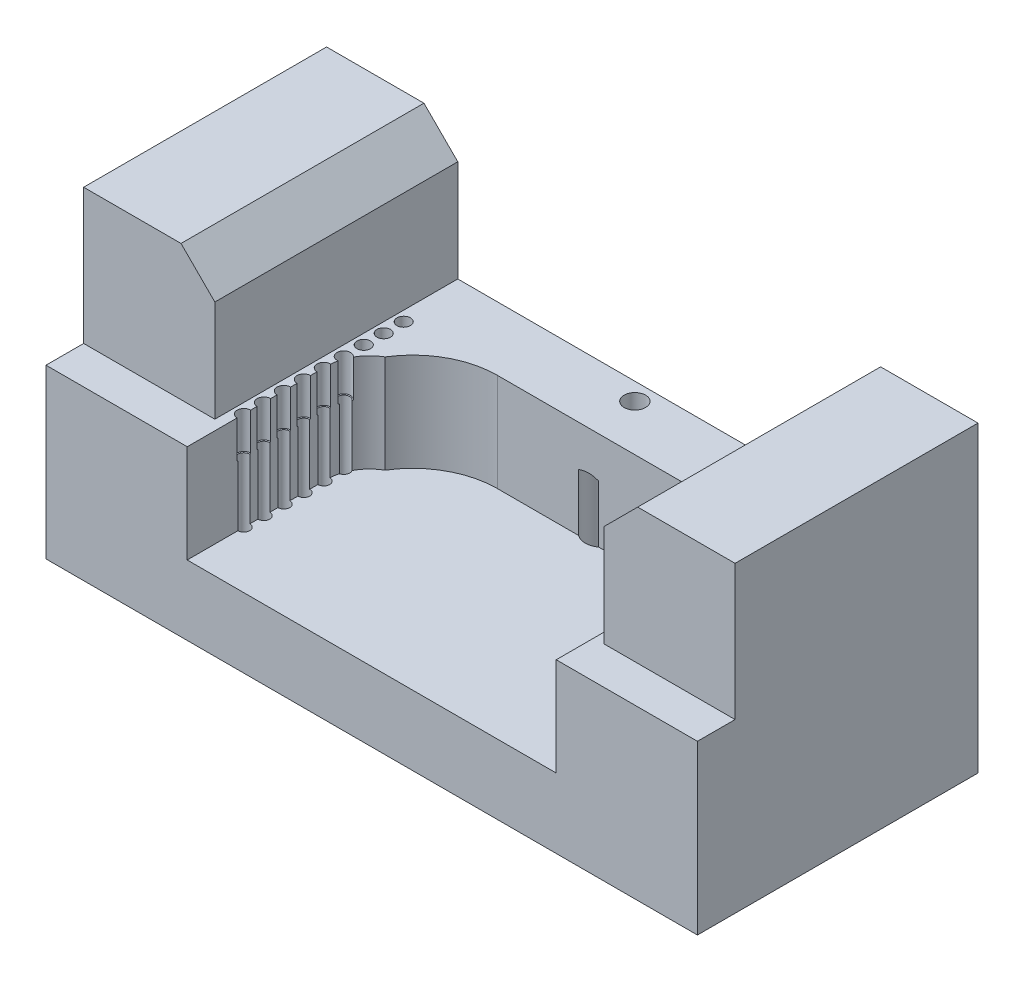
from build123d import *

# Parameters (mm, degrees)
SKETCH2_W                        = 48.915002
SKETCH2_H                        = 21.0677944
BOSS_EXTRUDE1_DEPTH              = 12.599999946
SKETCH1_R                        = 0.4445
CUT_EXTRUDE1_DEPTH               = 36.740394334
SKETCH3_R                        = 0.508
CUT_EXTRUDE2_DEPTH               = 2.794
SKETCH4_W                        = 9.852501
SKETCH4_H                        = 18.2412951
BOSS_EXTRUDE2_DEPTH              = 10.16
CHAMFER1_SIZE                    = 2.54
SKETCH5_W                        = 26.416
SKETCH5_H                        = 26.766649332
CUT_EXTRUDE3_DEPTH               = 7.366
FILLET1_R                        = 6.35
F_52_0_0635_DIAMETER_HOLE1_D     = 1.6129
F_52_0_0635_DIAMETER_HOLE1_DEPTH = 3.0988
F_52_0_0635_DIAMETER_HOLE1_TIP   = 0.484564046
CUT_EXTRUDE4_DEPTH               = 7.366
F_39_0_0995_DIAMETER_HOLE1_D     = 2.5273
F_39_0_0995_DIAMETER_HOLE1_DEPTH = 9.525
F_39_0_0995_DIAMETER_HOLE1_TIP   = 0.759277521


# Read off the part's stored shape, not the designer's step: Cut-Extrude6
with BuildPart() as part:
    # Sketch2 → Boss-Extrude1 (new body)
    with BuildSketch(Plane(origin=(0, 0, 0), x_dir=(1, 0, 0), z_dir=(0, 1, 0))):
        with Locations((0, 12.2793979)):
            Rectangle(SKETCH2_W, SKETCH2_H)
    extrude(amount=-BOSS_EXTRUDE1_DEPTH)

    # Sketch1 → Cut-Extrude1 (cut, through all)
    with BuildSketch(Plane(origin=(0, 0, 0), x_dir=(1, 0, 0), z_dir=(0, 1, 0))):
        with Locations(Location((-13.853001, 6.0000007, 0), (0, 0, 270))):
            Circle(SKETCH1_R)
        with Locations(Location((13.853001, 5.78000114, 0), (0, 0, 270))):
            Circle(SKETCH1_R)
        with Locations(Location((-13.853001, 7.5, 0), (0, 0, 270))):
            Circle(SKETCH1_R)
        with Locations(Location((13.853001, 7.28000044, 0), (0, 0, 270))):
            Circle(SKETCH1_R)
        with Locations(Location((-13.853001, 8.9999993, 0), (0, 0, 270))):
            Circle(SKETCH1_R)
        with Locations(Location((13.853001, 8.77999974, 0), (0, 0, 270))):
            Circle(SKETCH1_R)
        with Locations(Location((-13.853001, 10.4999986, 0), (0, 0, 270))):
            Circle(SKETCH1_R)
        with Locations(Location((13.853001, 10.27999904, 0), (0, 0, 270))):
            Circle(SKETCH1_R)
        with Locations(Location((-13.853001, 11.9999979, 0), (0, 0, 270))):
            Circle(SKETCH1_R)
        with Locations(Location((13.853001, 11.77999834, 0), (0, 0, 270))):
            Circle(SKETCH1_R)
        with Locations(Location((-13.853001, 13.4999972, 0), (0, 0, 270))):
            Circle(SKETCH1_R)
        with Locations(Location((13.853001, 13.27999764, 0), (0, 0, 270))):
            Circle(SKETCH1_R)
        with Locations(Location((-13.853001, 14.9999965, 0), (0, 0, 270))):
            Circle(SKETCH1_R)
        with Locations(Location((13.853001, 14.77999694, 0), (0, 0, 270))):
            Circle(SKETCH1_R)
        with Locations(Location((-13.853001, 16.4999958, 0), (0, 0, 270))):
            Circle(SKETCH1_R)
        with Locations(Location((13.853001, 16.27999624, 0), (0, 0, 270))):
            Circle(SKETCH1_R)
        with Locations(Location((-13.853001, 17.9999951, 0), (0, 0, 270))):
            Circle(SKETCH1_R)
        with Locations(Location((13.853001, 17.77999554, 0), (0, 0, 270))):
            Circle(SKETCH1_R)
    extrude(amount=-CUT_EXTRUDE1_DEPTH, mode=Mode.SUBTRACT)

    # Sketch3 → Cut-Extrude2 (cut)
    with BuildSketch(Plane(origin=(0, 0, 0), x_dir=(1, 0, 0), z_dir=(0, 1, 0))):
        with Locations(Location((-13.853001, 6.0000007, 0), (0, 0, 270))):
            Circle(SKETCH3_R)
        with Locations(Location((13.853001, 5.78000114, 0), (0, 0, 270))):
            Circle(SKETCH3_R)
        with Locations(Location((-13.853001, 7.5, 0), (0, 0, 270))):
            Circle(SKETCH3_R)
        with Locations(Location((13.853001, 7.28000044, 0), (0, 0, 270))):
            Circle(SKETCH3_R)
        with Locations(Location((-13.853001, 8.9999993, 0), (0, 0, 270))):
            Circle(SKETCH3_R)
        with Locations(Location((13.853001, 8.77999974, 0), (0, 0, 270))):
            Circle(SKETCH3_R)
        with Locations(Location((-13.853001, 10.4999986, 0), (0, 0, 270))):
            Circle(SKETCH3_R)
        with Locations(Location((13.853001, 10.27999904, 0), (0, 0, 270))):
            Circle(SKETCH3_R)
        with Locations(Location((-13.853001, 11.9999979, 0), (0, 0, 270))):
            Circle(SKETCH3_R)
        with Locations(Location((13.853001, 11.77999834, 0), (0, 0, 270))):
            Circle(SKETCH3_R)
        with Locations(Location((-13.853001, 13.4999972, 0), (0, 0, 270))):
            Circle(SKETCH3_R)
        with Locations(Location((13.853001, 13.27999764, 0), (0, 0, 270))):
            Circle(SKETCH3_R)
        with Locations(Location((-13.853001, 14.9999965, 0), (0, 0, 270))):
            Circle(SKETCH3_R)
        with Locations(Location((13.853001, 14.77999694, 0), (0, 0, 270))):
            Circle(SKETCH3_R)
        with Locations(Location((-13.853001, 16.4999958, 0), (0, 0, 270))):
            Circle(SKETCH3_R)
        with Locations(Location((13.853001, 16.27999624, 0), (0, 0, 270))):
            Circle(SKETCH3_R)
        with Locations(Location((-13.853001, 17.9999951, 0), (0, 0, 270))):
            Circle(SKETCH3_R)
        with Locations(Location((13.853001, 17.77999554, 0), (0, 0, 270))):
            Circle(SKETCH3_R)
    extrude(amount=-CUT_EXTRUDE2_DEPTH, mode=Mode.SUBTRACT)

    # Sketch4 → Boss-Extrude2 (add)
    with BuildSketch(Plane(origin=(0, 0, 0), x_dir=(1, 0, 0), z_dir=(0, 1, 0))):
        with Locations((-19.5312505, 13.69264755)):
            Rectangle(SKETCH4_W, SKETCH4_H)
        with Locations((19.5312505, 13.69264755)):
            Rectangle(SKETCH4_W, SKETCH4_H)
    extrude(amount=BOSS_EXTRUDE2_DEPTH)

    # Chamfer1
    chamfer1_edges = [part.edges().sort_by_distance(p)[0] for p in [
        (14.605, 10.16, -13.69264755),
        (-14.605, 10.16, -13.69264755),
    ]]
    chamfer(chamfer1_edges, length=CHAMFER1_SIZE)

    # Sketch5 → Cut-Extrude3 (cut)
    with BuildSketch(Plane(origin=(0, 0, 0), x_dir=(1, 0, 0), z_dir=(0, 1, 0))):
        with Locations((0, 4.650675334)):
            Rectangle(SKETCH5_W, SKETCH5_H)
    extrude(amount=-CUT_EXTRUDE3_DEPTH, mode=Mode.SUBTRACT)

    # Fillet1
    fillet1_edges = [part.edges().sort_by_distance(p)[0] for p in [
        (13.208, -3.683, -18.034),
        (-13.208, -3.683, -18.034),
    ]]
    fillet(fillet1_edges, radius=FILLET1_R)

    # #52 (0.0635) Diameter Hole1
    with Locations(Plane(origin=(0, 0, 0), x_dir=(1, 0, 0), z_dir=(0, 1, 0))):
        with Locations((0, 21.50320058)):
            Hole(F_52_0_0635_DIAMETER_HOLE1_D / 2, depth=F_52_0_0635_DIAMETER_HOLE1_DEPTH)
            with Locations((0, 0, -(F_52_0_0635_DIAMETER_HOLE1_DEPTH + F_52_0_0635_DIAMETER_HOLE1_TIP / 2))):  # 118° drill point
                Cone(0, F_52_0_0635_DIAMETER_HOLE1_D / 2, F_52_0_0635_DIAMETER_HOLE1_TIP, mode=Mode.SUBTRACT)

    # Sketch9 → Cut-Extrude4 (cut)
    with BuildSketch(Plane(origin=(0, 0, 0), x_dir=(1, 0, 0), z_dir=(0, 1, 0))):
        with BuildLine():
            Line((-13.853001, 0), (13.853001, 0))
            Line((13.853001, 0), (13.853001, 12.264332778))
            ThreePointArc((13.853001, 12.264332778), (12.92306503, 14.509396808), (10.678001, 15.439332778))
            Line((10.678001, 15.439332778), (-10.678001, 15.439332778))
            ThreePointArc((-10.678001, 15.439332778), (-12.92306503, 14.509396808), (-13.853001, 12.264332778))
            Line((-13.853001, 12.264332778), (-13.853001, 0))
        make_face()
    extrude(amount=-CUT_EXTRUDE4_DEPTH, mode=Mode.SUBTRACT)

    # Cut-Extrude6 outline → Cut-Extrude6 (revolve, cut)
    with BuildSketch(Plane(origin=(-13.853001, 0, -6.0000007), x_dir=(1, 0, 0), z_dir=(0, 0, 1))):
        Polygon((0.4445, -2.794), (0.4445, -2.832154649), (0.508, -2.794), align=None)
    revolve(axis=Axis((-13.853001, 0, -6.0000007), (0, 1, 0)), mode=Mode.SUBTRACT)

    # Cut-Extrude6 2 outline → Cut-Extrude6 2 (revolve, cut)
    with BuildSketch(Plane(origin=(13.853001, 0, -5.78000114), x_dir=(1, 0, 0), z_dir=(0, 0, 1))):
        Polygon((0.4445, -2.794), (0.4445, -2.832154649), (0.508, -2.794), align=None)
    revolve(axis=Axis((13.853001, 0, -5.78000114), (0, 1, 0)), mode=Mode.SUBTRACT)

    # Cut-Extrude6 3 outline → Cut-Extrude6 3 (revolve, cut)
    with BuildSketch(Plane(origin=(-13.853001, 0, -7.5), x_dir=(1, 0, 0), z_dir=(0, 0, 1))):
        Polygon((0.4445, -2.794), (0.4445, -2.832154649), (0.508, -2.794), align=None)
    revolve(axis=Axis((-13.853001, 0, -7.5), (0, 1, 0)), mode=Mode.SUBTRACT)

    # Cut-Extrude6 4 outline → Cut-Extrude6 4 (revolve, cut)
    with BuildSketch(Plane(origin=(13.853001, 0, -7.28000044), x_dir=(1, 0, 0), z_dir=(0, 0, 1))):
        Polygon((0.4445, -2.794), (0.4445, -2.832154649), (0.508, -2.794), align=None)
    revolve(axis=Axis((13.853001, 0, -7.28000044), (0, 1, 0)), mode=Mode.SUBTRACT)

    # Cut-Extrude6 5 outline → Cut-Extrude6 5 (revolve, cut)
    with BuildSketch(Plane(origin=(-13.853001, 0, -8.9999993), x_dir=(1, 0, 0), z_dir=(0, 0, 1))):
        Polygon((0.4445, -2.794), (0.4445, -2.832154649), (0.508, -2.794), align=None)
    revolve(axis=Axis((-13.853001, 0, -8.9999993), (0, 1, 0)), mode=Mode.SUBTRACT)

    # Cut-Extrude6 6 outline → Cut-Extrude6 6 (revolve, cut)
    with BuildSketch(Plane(origin=(13.853001, 0, -8.77999974), x_dir=(1, 0, 0), z_dir=(0, 0, 1))):
        Polygon((0.4445, -2.794), (0.4445, -2.832154649), (0.508, -2.794), align=None)
    revolve(axis=Axis((13.853001, 0, -8.77999974), (0, 1, 0)), mode=Mode.SUBTRACT)

    # Cut-Extrude6 7 outline → Cut-Extrude6 7 (revolve, cut)
    with BuildSketch(Plane(origin=(-13.853001, 0, -10.4999986), x_dir=(1, 0, 0), z_dir=(0, 0, 1))):
        Polygon((0.4445, -2.794), (0.4445, -2.832154649), (0.508, -2.794), align=None)
    revolve(axis=Axis((-13.853001, 0, -10.4999986), (0, 1, 0)), mode=Mode.SUBTRACT)

    # Cut-Extrude6 8 outline → Cut-Extrude6 8 (revolve, cut)
    with BuildSketch(Plane(origin=(13.853001, 0, -10.27999904), x_dir=(1, 0, 0), z_dir=(0, 0, 1))):
        Polygon((0.4445, -2.794), (0.4445, -2.832154649), (0.508, -2.794), align=None)
    revolve(axis=Axis((13.853001, 0, -10.27999904), (0, 1, 0)), mode=Mode.SUBTRACT)

    # Cut-Extrude6 9 outline → Cut-Extrude6 9 (revolve, cut)
    with BuildSketch(Plane(origin=(-13.853001, 0, -11.9999979), x_dir=(1, 0, 0), z_dir=(0, 0, 1))):
        Polygon((0.4445, -2.794), (0.4445, -2.832154649), (0.508, -2.794), align=None)
    revolve(axis=Axis((-13.853001, 0, -11.9999979), (0, 1, 0)), mode=Mode.SUBTRACT)

    # Cut-Extrude6 10 outline → Cut-Extrude6 10 (revolve, cut)
    with BuildSketch(Plane(origin=(13.853001, 0, -11.77999834), x_dir=(1, 0, 0), z_dir=(0, 0, 1))):
        Polygon((0.4445, -2.794), (0.4445, -2.832154649), (0.508, -2.794), align=None)
    revolve(axis=Axis((13.853001, 0, -11.77999834), (0, 1, 0)), mode=Mode.SUBTRACT)

    # Cut-Extrude6 11 outline → Cut-Extrude6 11 (revolve, cut)
    with BuildSketch(Plane(origin=(-13.853001, 0, -13.4999972), x_dir=(1, 0, 0), z_dir=(0, 0, 1))):
        Polygon((0.4445, -2.794), (0.4445, -2.832154649), (0.508, -2.794), align=None)
    revolve(axis=Axis((-13.853001, 0, -13.4999972), (0, 1, 0)), mode=Mode.SUBTRACT)

    # Cut-Extrude6 12 outline → Cut-Extrude6 12 (revolve, cut)
    with BuildSketch(Plane(origin=(13.853001, 0, -13.27999764), x_dir=(1, 0, 0), z_dir=(0, 0, 1))):
        Polygon((0.4445, -2.794), (0.4445, -2.832154649), (0.508, -2.794), align=None)
    revolve(axis=Axis((13.853001, 0, -13.27999764), (0, 1, 0)), mode=Mode.SUBTRACT)

    # Cut-Extrude6 13 outline → Cut-Extrude6 13 (revolve, cut)
    with BuildSketch(Plane(origin=(-13.853001, 0, -14.9999965), x_dir=(1, 0, 0), z_dir=(0, 0, 1))):
        Polygon((0.4445, -2.794), (0.4445, -2.832154649), (0.508, -2.794), align=None)
    revolve(axis=Axis((-13.853001, 0, -14.9999965), (0, 1, 0)), mode=Mode.SUBTRACT)

    # Cut-Extrude6 14 outline → Cut-Extrude6 14 (revolve, cut)
    with BuildSketch(Plane(origin=(13.853001, 0, -14.77999694), x_dir=(1, 0, 0), z_dir=(0, 0, 1))):
        Polygon((0.4445, -2.794), (0.4445, -2.832154649), (0.508, -2.794), align=None)
    revolve(axis=Axis((13.853001, 0, -14.77999694), (0, 1, 0)), mode=Mode.SUBTRACT)

    # Cut-Extrude6 15 outline → Cut-Extrude6 15 (revolve, cut)
    with BuildSketch(Plane(origin=(-13.853001, 0, -16.4999958), x_dir=(1, 0, 0), z_dir=(0, 0, 1))):
        Polygon((0.4445, -2.794), (0.4445, -2.832154649), (0.508, -2.794), align=None)
    revolve(axis=Axis((-13.853001, 0, -16.4999958), (0, 1, 0)), mode=Mode.SUBTRACT)

    # Cut-Extrude6 16 outline → Cut-Extrude6 16 (revolve, cut)
    with BuildSketch(Plane(origin=(13.853001, 0, -16.27999624), x_dir=(1, 0, 0), z_dir=(0, 0, 1))):
        Polygon((0.4445, -2.794), (0.4445, -2.832154649), (0.508, -2.794), align=None)
    revolve(axis=Axis((13.853001, 0, -16.27999624), (0, 1, 0)), mode=Mode.SUBTRACT)

    # Cut-Extrude6 17 outline → Cut-Extrude6 17 (revolve, cut)
    with BuildSketch(Plane(origin=(-13.853001, 0, -17.9999951), x_dir=(1, 0, 0), z_dir=(0, 0, 1))):
        Polygon((0.4445, -2.794), (0.4445, -2.832154649), (0.508, -2.794), align=None)
    revolve(axis=Axis((-13.853001, 0, -17.9999951), (0, 1, 0)), mode=Mode.SUBTRACT)

    # Cut-Extrude6 18 outline → Cut-Extrude6 18 (revolve, cut)
    with BuildSketch(Plane(origin=(13.853001, 0, -17.77999554), x_dir=(1, 0, 0), z_dir=(0, 0, 1))):
        Polygon((0.4445, -2.794), (0.4445, -2.832154649), (0.508, -2.794), align=None)
    revolve(axis=Axis((13.853001, 0, -17.77999554), (0, 1, 0)), mode=Mode.SUBTRACT)

    # #39 (0.0995) Diameter Hole1
    with Locations(Plane(origin=(0, -12.599999946, 0), x_dir=(-1, 0, 0), z_dir=(0, -1, 0))):
        with Locations((20.32, 6.35), (0, 19.05), (-20.32, 6.35)):
            Hole(F_39_0_0995_DIAMETER_HOLE1_D / 2, depth=F_39_0_0995_DIAMETER_HOLE1_DEPTH)
            with Locations((0, 0, -(F_39_0_0995_DIAMETER_HOLE1_DEPTH + F_39_0_0995_DIAMETER_HOLE1_TIP / 2))):  # 118° drill point
                Cone(0, F_39_0_0995_DIAMETER_HOLE1_D / 2, F_39_0_0995_DIAMETER_HOLE1_TIP, mode=Mode.SUBTRACT)


solid = part.part
